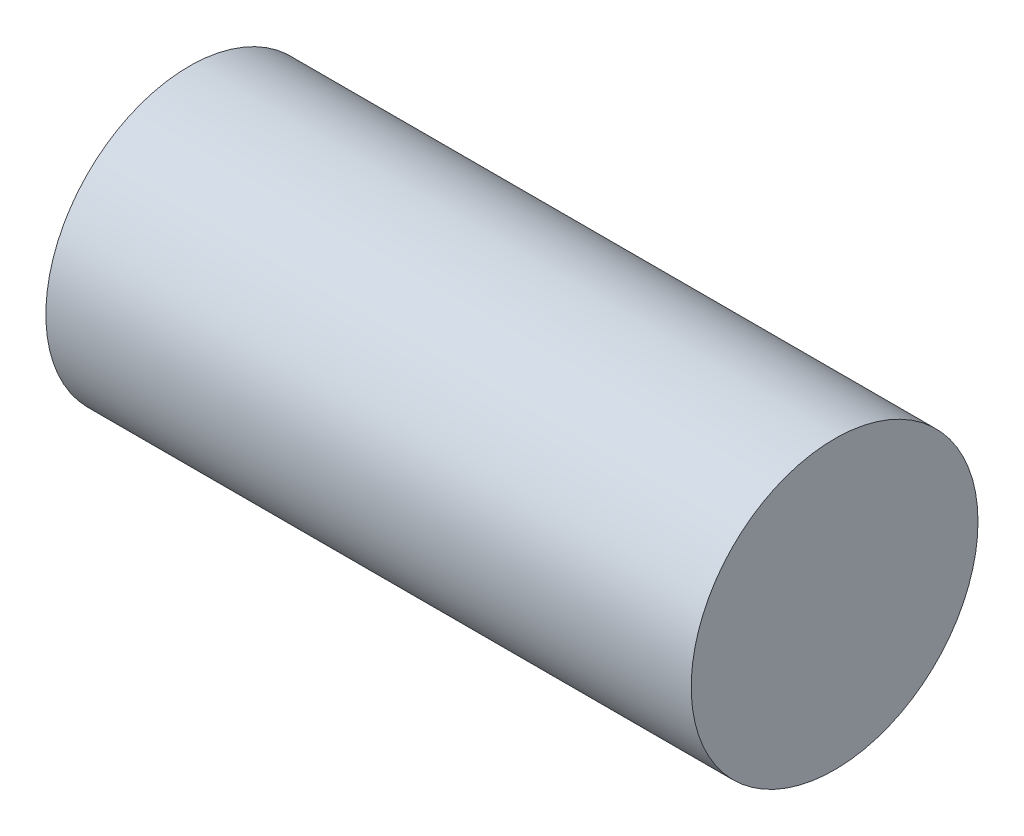
from build123d import *

# Parameters (mm, degrees)
SCHIZZO1_R                   = 4
ESTRUSIONE_ESTRUSIONE1_DEPTH = 18


with BuildPart() as part:
    # Schizzo1 → Estrusione-Estrusione1 (new body)
    with BuildSketch(Plane(origin=(0, 0, 0), x_dir=(0, 0, -1), z_dir=(1, 0, 0))):
        Circle(SCHIZZO1_R)
    extrude(amount=ESTRUSIONE_ESTRUSIONE1_DEPTH)


solid = part.part
